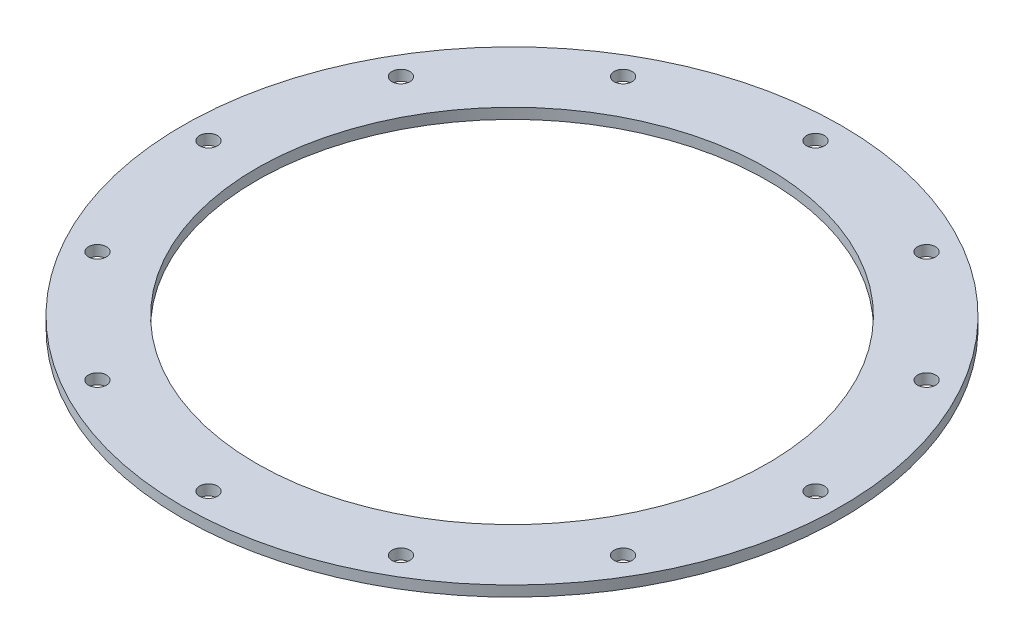
from build123d import *

# Parameters (mm, degrees)
SKETCH1_W                    = 11.176
SKETCH1_H                    = 1.5875
F_36_0_1065_DIAMETER_HOLE1_D = 2.7051
SCREW_PASSTHROUGHS_COUNT     = 12


with BuildPart() as part:
    # Sketch1 → Main (revolve)
    with BuildSketch(Plane.XY):
        with Locations((-44.196, 0.79375)):
            Rectangle(SKETCH1_W, SKETCH1_H)
    revolve(axis=Axis((0, 55, 0), (0, -1, 0)))

    # #36 (0.1065) Diameter Hole1 (through all)
    with Locations(Plane(origin=(0, 0, 0), x_dir=(-1, 0, 0), z_dir=(0, -1, 0))):
        with Locations((45.847, 0)):
            f_36_0_1065_diameter_hole1 = Hole(F_36_0_1065_DIAMETER_HOLE1_D / 2)

    # Screw Passthroughs: #36 (0.1065) Diameter Hole1 ×12 about axis
    screw_passthroughs_axis = Axis((0, 55, 0), (0, -1, 0))
    for i in range(1, SCREW_PASSTHROUGHS_COUNT):
        add(f_36_0_1065_diameter_hole1.rotate(screw_passthroughs_axis, i * 360 / SCREW_PASSTHROUGHS_COUNT), mode=Mode.SUBTRACT)


solid = part.part
